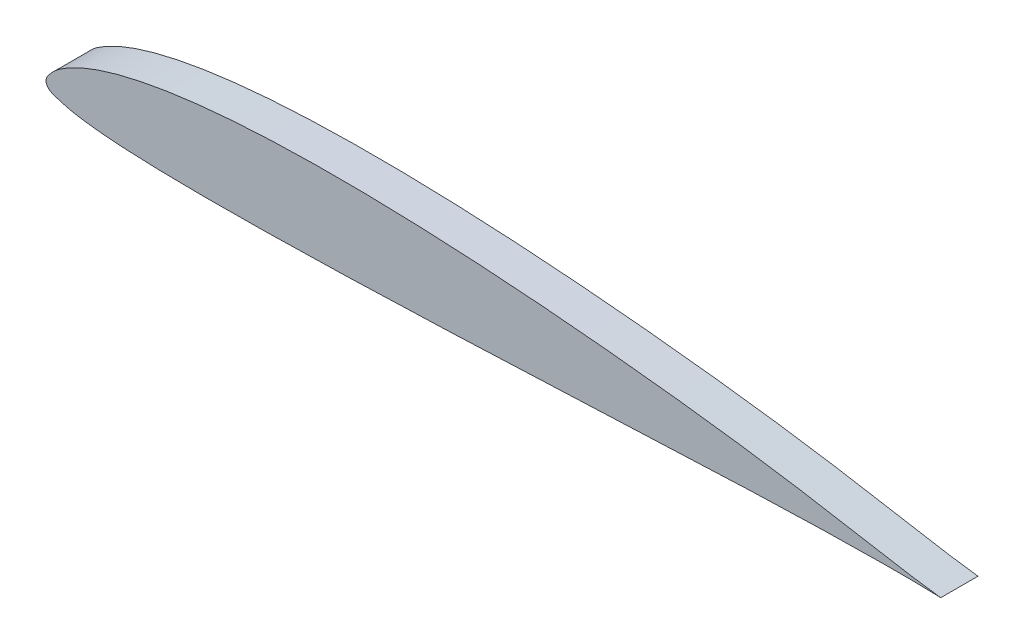
from build123d import *

# Parameters (mm, degrees)
BOSS_EXTRUDE1_DEPTH = 6.35


with BuildPart() as part:
    # Sketch1 → Boss-Extrude1 (new body)
    with BuildSketch(Plane.XY):
        with BuildLine():
            add(Edge.make_bspline(
                [(152.4, 0), (152.232833718, 0.018502415), (151.571843934, 0.091662545), (150.113999557, 0.2838596), (147.749385864, 0.638650629), (144.555943786, 1.170157002), (140.615360499, 1.859099247), (136.007834995, 2.67146013), (130.806388019, 3.562840017), (125.073826155, 4.486154777), (118.864690135, 5.397753278), (112.233312125, 6.272974236), (105.243489487, 7.106058892), (97.969665406, 7.889319693), (90.492724993, 8.606734858), (82.895253241, 9.240670251), (75.258667902, 9.77749908), (67.662928423, 10.198815718), (60.186827499, 10.49170102), (52.905945954, 10.645080099), (45.891743713, 10.644551806), (39.210681048, 10.486247597), (32.923263797, 10.164412711), (27.083700854, 9.670939726), (21.73719754, 9.016508091), (16.924344759, 8.204081974), (12.676275305, 7.249770479), (9.019815693, 6.174457771), (5.965694819, 5.002018522), (3.544032537, 3.769871526), (1.704834708, 2.531499726), (0.575239506, 1.344737529), (-0.170728015, 0.20310696), (0.337603285, -1.001772228), (1.792943226, -1.546726795), (3.794232235, -2.17716446), (6.643400201, -2.643922316), (10.216110654, -3.041953632), (14.530084187, -3.319872228), (19.533969629, -3.497677255), (25.18692206, -3.577638345), (31.428627275, -3.573848082), (38.191948203, -3.496581442), (45.401595317, -3.349308986), (52.97841726, -3.141841288), (60.83867414, -2.885262261), (68.894988424, -2.587930905), (77.057432025, -2.258882887), (85.235009672, -1.907730283), (93.335426834, -1.550168819), (101.266049649, -1.195465221), (108.93417081, -0.862411006), (116.2464986, -0.557504045), (123.110150899, -0.306936183), (129.431690533, -0.107922528), (135.123521438, 0.027974451), (140.103603919, 0.108900525), (144.29941542, 0.13993859), (147.644768246, 0.124243061), (150.083437285, 0.086502888), (151.399782071, 0.04034956), (151.898604, 0.02286)],
                knots=[0, 0, 0, 0, 0.001635356, 0.006466337, 0.014296592, 0.024884209, 0.037943993, 0.053194137, 0.070376569, 0.089257218, 0.109651763, 0.131396199, 0.15429467, 0.178096903, 0.202530723, 0.227328973, 0.252225807, 0.276966075, 0.301296827, 0.324972089, 0.347773046, 0.369493849, 0.389946985, 0.408979416, 0.42646579, 0.442306729, 0.45642124, 0.468773538, 0.47934515, 0.488155641, 0.495223141, 0.500608248, 0.504417036, 0.507344225, 0.511892731, 0.518766333, 0.5280624, 0.539750485, 0.553781924, 0.570059197, 0.588441486, 0.608747967, 0.630750044, 0.65420771, 0.678865071, 0.70445057, 0.730677503, 0.757253937, 0.783882587, 0.810265561, 0.836095192, 0.861073222, 0.884896986, 0.907258357, 0.92785625, 0.946394646, 0.962618154, 0.976286171, 0.987192828, 0.99514679, 1, 1, 1, 1], degree=3))
            Line((151.898604, 0.02286), (152.4, 0))
        make_face()
    extrude(amount=BOSS_EXTRUDE1_DEPTH)


solid = part.part
